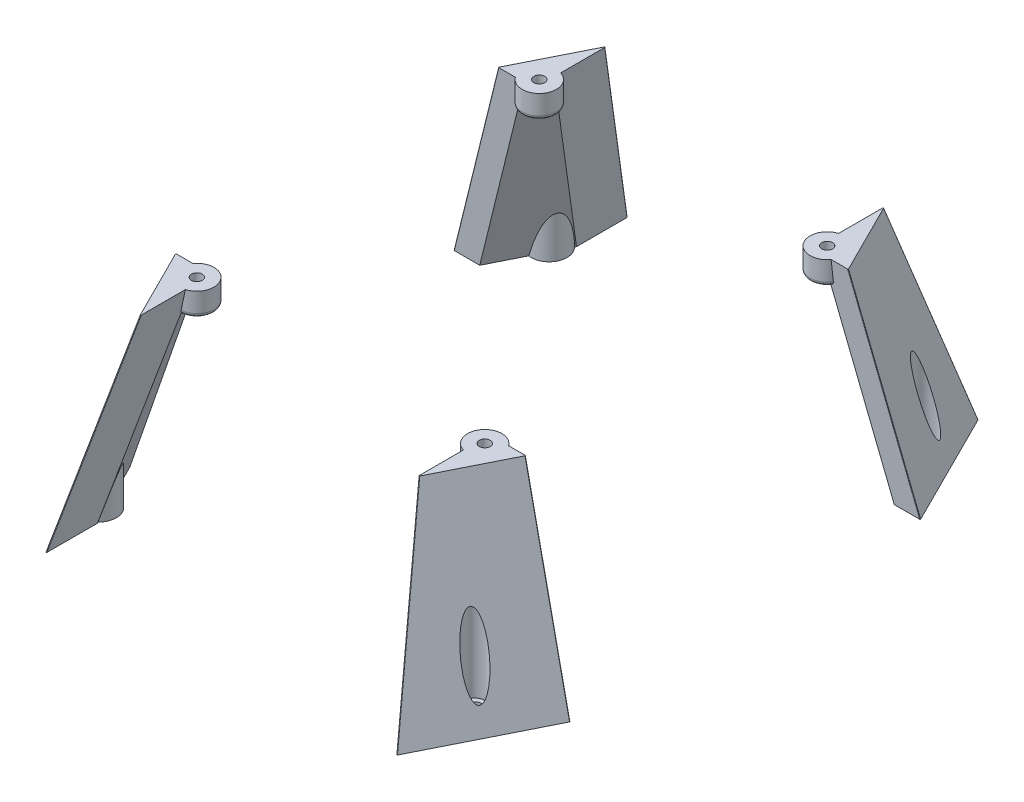
from build123d import *
from build123d.topology import SkipClean

# Parameters (mm, degrees)
SKETCH1_W                       = 120
SKETCH1_H                       = 150
BOSS_EXTRUDE1_DEPTH             = 3
BOSS_EXTRUDE2_REACH             = 98.094
BOSS_EXTRUDE2_DIRECTION_2_REACH = 98.094
CUT_EXTRUDE1_START              = 18
CUT_EXTRUDE1_DEPTH              = 50.8
CUT_EXTRUDE2_DEPTH              = 99.222526147
BOSS_EXTRUDE3_DEPTH             = 4
CUT_EXTRUDE3_DEPTH              = 4
CUT_EXTRUDE4_DEPTH              = 109.282039309
SKETCH10_R                      = 4.4
SKETCH10_R_2                    = 1.4
BOSS_EXTRUDE4_DEPTH             = 6
SKETCH10_2_R                    = 1.4
CUT_EXTRUDE5_DEPTH              = 109.282039309
FILLET1_R                       = 1
FILLET2_R                       = 1
FILLET3_R                       = 1
FILLET4_R                       = 1
BOSS_EXTRUDE5_START             = -10.666667
BOSS_EXTRUDE5_DEPTH             = 10.666667
BOSS_EXTRUDE7_START             = -10.666667
BOSS_EXTRUDE7_DEPTH             = 10.666667
BOSS_EXTRUDE8_START             = -10.666667
BOSS_EXTRUDE8_DEPTH             = 10.666667
BOSS_EXTRUDE9_START             = -10.666667
BOSS_EXTRUDE9_DEPTH             = 10.666667
SKETCH12_3_R                    = 1.6
CUT_EXTRUDE6_DEPTH              = 109.282039309
CUT_EXTRUDE7_START              = -4
SKETCH13_R                      = 2.75
CUT_EXTRUDE7_DEPTH              = 105.282039309
FILLET5_R                       = 0.1
FILLET6_R                       = 0.1
FILLET7_R                       = 0.1
FILLET8_R                       = 0.1


# Read off the part's stored shape, not the designer's step: Mirror3
with BuildPart() as part:
    # Sketch1 → Boss-Extrude1 (new, symmetric)
    with BuildSketch(Plane(origin=(0, 0, 0), x_dir=(1, 0, 0), z_dir=(0, 1, 0))):
        Rectangle(SKETCH1_W, SKETCH1_H)
    extrude(amount=BOSS_EXTRUDE1_DEPTH, both=True)

    # Boss-Extrude2: up to this face of the body (flat: up to its plane)
    boss_extrude2_end = Plane(part.part.faces().sort_by_distance((0, 0, 75))[0])
    # Sketch2 → Boss-Extrude2 (add, up to the picked face)
    with BuildSketch(Plane.XY, mode=Mode.PRIVATE) as boss_extrude2_sk1:
        Polygon((-60, -3), (-60, -17.558809371), (-20, -3), align=None)
    boss_extrude2_tool1 = split(extrude(boss_extrude2_sk1.sketch, amount=BOSS_EXTRUDE2_REACH, mode=Mode.PRIVATE), bisect_by=boss_extrude2_end, keep=Keep.BOTH, mode=Mode.PRIVATE)
    # Sketch2 → Boss-Extrude2 (add, up to the picked face)
    with BuildSketch(Plane.XY, mode=Mode.PRIVATE) as boss_extrude2_sk2:
        Polygon((20, -3), (60, -3), (60, -17.558809371), align=None)
    boss_extrude2_tool2 = split(extrude(boss_extrude2_sk2.sketch, amount=BOSS_EXTRUDE2_REACH, mode=Mode.PRIVATE), bisect_by=boss_extrude2_end, keep=Keep.BOTH, mode=Mode.PRIVATE)
    add(boss_extrude2_tool1.solids().sort_by(Axis((-46.666667, -7.852936, 0), (0, 0, 1)))[0])
    add(boss_extrude2_tool2.solids().sort_by(Axis((46.666667, -7.852936, 0), (0, 0, 1)))[0])

    # Boss-Extrude2 direction 2: up to this face of the body (flat: up to its plane)
    boss_extrude2_direction_2_end = Plane(part.part.faces().sort_by_distance((0, 0, -75))[0])
    # Sketch2 → Boss-Extrude2 direction 2 (add, up to the picked face)
    with BuildSketch(Plane.XY, mode=Mode.PRIVATE) as boss_extrude2_direction_2_sk1:
        Polygon((-60, -3), (-60, -17.558809371), (-20, -3), align=None)
    boss_extrude2_direction_2_tool1 = split(extrude(boss_extrude2_direction_2_sk1.sketch, amount=-BOSS_EXTRUDE2_DIRECTION_2_REACH, mode=Mode.PRIVATE), bisect_by=boss_extrude2_direction_2_end, keep=Keep.BOTH, mode=Mode.PRIVATE)
    # Sketch2 → Boss-Extrude2 direction 2 (add, up to the picked face)
    with BuildSketch(Plane.XY, mode=Mode.PRIVATE) as boss_extrude2_direction_2_sk2:
        Polygon((20, -3), (60, -3), (60, -17.558809371), align=None)
    boss_extrude2_direction_2_tool2 = split(extrude(boss_extrude2_direction_2_sk2.sketch, amount=-BOSS_EXTRUDE2_DIRECTION_2_REACH, mode=Mode.PRIVATE), bisect_by=boss_extrude2_direction_2_end, keep=Keep.BOTH, mode=Mode.PRIVATE)
    add(boss_extrude2_direction_2_tool1.solids().sort_by(Axis((-46.666667, -7.852936, 0), (0, 0, -1)))[0])
    add(boss_extrude2_direction_2_tool2.solids().sort_by(Axis((46.666667, -7.852936, 0), (0, 0, -1)))[0])

    # Sketch3 → Cut-Extrude1 (cut)
    with BuildSketch(Plane.XY.offset(CUT_EXTRUDE1_START)):
        Polygon((-20, -3), (-46.314239601, -3), (-60, -7.981209418), (-60, -13.302098281), (-45.432604698, -8), (-33.737387097, -8), align=None)
        Polygon((33.737387097, -8), (20, -3), (46.314239601, -3), (60, -7.981209418), (60, -13.302098281), (45.432604698, -8), align=None)
    cut_extrude1 = extrude(amount=CUT_EXTRUDE1_DEPTH, mode=Mode.SUBTRACT)

    # Mirror1: Cut-Extrude1 across plane
    add(cut_extrude1.mirror(Plane.XY), mode=Mode.SUBTRACT)

    # Sketch5 → Cut-Extrude2 (cut, through all)
    with BuildSketch(Plane(origin=(0, 3, 0), x_dir=(1, 0, 0), z_dir=(0, 1, 0))):
        Polygon((-60, -75), (-60, -45), (-45, -75), align=None)
        Polygon((45, -75), (60, -75), (60, -45), align=None)
        Polygon((60, 75), (60, 45), (45, 75), align=None)
        Polygon((-45, 75), (-60, 75), (-60, 45), align=None)
    extrude(amount=-CUT_EXTRUDE2_DEPTH, mode=Mode.SUBTRACT)



with BuildPart() as body_2:
    # Sketch4 → Boss-Extrude3 (new body)
    with BuildSketch(Plane(origin=(0, 53, 0), x_dir=(1, 0, 0), z_dir=(0, 1, 0))):
        Polygon((-35.729490169, 60), (-45, 41.458980338), (-45, -41.458980338), (-35.729490169, -60), (35.729490169, -60), (45, -41.458980338), (45, 41.458980338), (35.729490169, 60), align=None)
    extrude(amount=BOSS_EXTRUDE3_DEPTH)


with BuildPart() as part_1:
    add(part.part)

    add(body_2.part)  # Loft3 merges body 2
    # Sketch6 → Loft3 section 0
    with BuildSketch(Plane(origin=(0, 3, 0), x_dir=(1, 0, 0), z_dir=(0, 1, 0))):
        with BuildLine():
            Line((-60, -45), (-53.291796068, -45))
            Line((-53.291796068, -45), (-45, -61.583592135))
            Line((-45, -61.583592135), (-45, -75))
            Line((-45, -75), (-60, -45))
        make_face()
    # Sketch7 → Loft3 section 1
    with BuildSketch(Plane(origin=(0, 53, 0), x_dir=(-1, 0, 0), z_dir=(0, -1, 0))):
        with BuildLine():
            Line((35.729490169, -60), (35.729490169, -46.583592135))
            Line((35.729490169, -46.583592135), (38.291796068, -41.458980338))
            Line((38.291796068, -41.458980338), (45, -41.458980338))
            Line((45, -41.458980338), (35.729490169, -60))
        make_face()
    loft3 = loft()

    # Mirror2: Loft3 across plane
    add(loft3.mirror(Plane(origin=(0, 0, 0), x_dir=(0, 0, 1), z_dir=(1, 0, 0))))

    # Mirror3: part across plane


with BuildPart() as part_2:
    add(part_1.part)
    add(part_1.part.mirror(Plane.XY))

    # Sketch8 → Cut-Extrude3 (cut)
    with BuildSketch(Plane(origin=(0, 57, 0), x_dir=(1, 0, 0), z_dir=(0, 1, 0))):
        Polygon((35.729490169, 60), (-35.729490169, 60), (-45, 41.458980338), (-45, -41.458980338), (-35.729490169, -60), (35.729490169, -60), (45, -41.458980338), (45, 41.458980338), align=None)
    extrude(amount=-CUT_EXTRUDE3_DEPTH, mode=Mode.SUBTRACT)

    # Sketch9 → Cut-Extrude4 (cut, through all)
    with BuildSketch(Plane(origin=(0, 3, 0), x_dir=(1, 0, 0), z_dir=(0, 1, 0))):
        Polygon((60, -45), (45, -75.0000125), (-45, -75), (-60, -45), (-60, 45), (-45, 75), (45, 75), (60, 45), align=None)
    extrude(amount=-CUT_EXTRUDE4_DEPTH, mode=Mode.SUBTRACT)


with BuildPart() as cut_extrude4_piece_1:
    # of the separate pieces the step leaves, piece 1, a body of its own (cut_extrude4_pieces)
    add(part_2.part.solids().sort_by_distance((-60, 3, -45))[0])



with BuildPart() as cut_extrude4_piece_2:
    # of the separate pieces the step leaves, piece 2, a body of its own (cut_extrude4_pieces)
    add(part_2.part.solids().sort_by_distance((-60, 3, 45))[0])


with BuildPart() as cut_extrude4_piece_3:
    # of the separate pieces the step leaves, piece 3, a body of its own (cut_extrude4_pieces)
    add(part_2.part.solids().sort_by_distance((60, 3, -45))[0])


with BuildPart() as cut_extrude4_piece_4:
    # of the separate pieces the step leaves, piece 4, a body of its own (cut_extrude4_pieces)
    add(part_2.part.solids().sort_by_distance((45, 3, 61.583592135))[0])


with BuildPart() as cut_extrude4_piece_1_1:
    add(cut_extrude4_piece_1.part)

    add(cut_extrude4_piece_2.part)  # Boss-Extrude4 merges Cut-Extrude4 piece 2

    add(cut_extrude4_piece_3.part)  # Boss-Extrude4 merges Cut-Extrude4 piece 3

    add(cut_extrude4_piece_4.part)  # Boss-Extrude4 merges Cut-Extrude4 piece 4
    # Sketch10 → Boss-Extrude4 (add)
    # profile 1 of 4: a face of its own
    with BuildSketch(Plane(origin=(0, 53, 0), x_dir=(1, 0, 0), z_dir=(0, 1, 0))):
        with Locations((-37.010643118, -44.021286236)):
            Circle(SKETCH10_R)
        with Locations(Location((-37.010643118, -44.021286236, 0), (0, 0, 270))):
            Circle(SKETCH10_R_2, mode=Mode.SUBTRACT)
    # profile 2 of 4: a face of its own
    with BuildSketch(Plane(origin=(0, 53, 0), x_dir=(1, 0, 0), z_dir=(0, 1, 0))):
        with Locations((37.010643118, -44.021286236)):
            Circle(SKETCH10_R)
        with Locations(Location((37.010643118, -44.021286236, 0), (0, 0, 243.434948823))):
            Circle(SKETCH10_R_2, mode=Mode.SUBTRACT)
    # profile 3 of 4: a face of its own
    with BuildSketch(Plane(origin=(0, 53, 0), x_dir=(1, 0, 0), z_dir=(0, 1, 0))):
        with Locations((37.010643118, 44.021286236)):
            Circle(SKETCH10_R)
        with Locations(Location((37.010643118, 44.021286236, 0), (0, 0, 270))):
            Circle(SKETCH10_R_2, mode=Mode.SUBTRACT)
    # profile 4 of 4: a face of its own
    with BuildSketch(Plane(origin=(0, 53, 0), x_dir=(1, 0, 0), z_dir=(0, 1, 0))):
        with Locations((-37.010643118, 44.021286236)):
            Circle(SKETCH10_R)
        with Locations(Location((-37.010643118, 44.021286236, 0), (0, 0, 243.434948823))):
            Circle(SKETCH10_R_2, mode=Mode.SUBTRACT)
    extrude(amount=-BOSS_EXTRUDE4_DEPTH)

    # Sketch10<2> → Cut-Extrude5 (cut, through all)
    with SkipClean():  # the faces are left unmerged after this step: merging them gives an invalid solid
        with BuildSketch(Plane(origin=(0, 53, 0), x_dir=(1, 0, 0), z_dir=(0, 1, 0))):
            with BuildLine():
                ThreePointArc((-36.384544084, -45.273484304), (-35.819731986, -44.757309793), (-35.610643118, -44.021286236))
                ThreePointArc((-35.610643118, -44.021286236), (-36.274619561, -42.830375105), (-37.636742152, -42.769088169))
                Line((-37.636742152, -42.769088169), (-36.384544084, -45.273484304))
            make_face()
            with BuildLine():
                Line((-36.384544084, -45.273484304), (-37.636742152, -42.769088169))
                ThreePointArc((-37.636742152, -42.769088169), (-38.262841186, -44.64738527), (-36.384544084, -45.273484304))
            make_face()
            with Locations(Location((37.010643118, -44.021286236, 0), (0, 0, 90))):
                Circle(SKETCH10_2_R)
            with Locations(Location((37.010643118, 44.021286236, 0), (0, 0, 270))):
                Circle(SKETCH10_2_R)
            with Locations(Location((-37.010643118, 44.021286236, 0), (0, 0, 90))):
                Circle(SKETCH10_2_R)
        extrude(amount=-CUT_EXTRUDE5_DEPTH, mode=Mode.SUBTRACT)

    # Fillet1
    fillet1_edges = [cut_extrude4_piece_1_1.edges().sort_by_distance(p)[0] for p in [
        (-33.261724109, 47, 41.717896068),
    ]]
    fillet(fillet1_edges, radius=FILLET1_R)

    # Fillet2
    fillet2_edges = [cut_extrude4_piece_1_1.edges().sort_by_distance(p)[0] for p in [
        (-33.261724109, 47, -41.717896068),
    ]]
    fillet(fillet2_edges, radius=FILLET2_R)

    # Fillet3
    fillet3_edges = [cut_extrude4_piece_1_1.edges().sort_by_distance(p)[0] for p in [
        (33.261724109, 47, -41.717896068),
    ]]
    fillet(fillet3_edges, radius=FILLET3_R)

    # Fillet4
    fillet4_edges = [cut_extrude4_piece_1_1.edges().sort_by_distance(p)[0] for p in [
        (33.261724109, 47, 41.717896068),
    ]]
    fillet(fillet4_edges, radius=FILLET4_R)

    # Sketch12 → Boss-Extrude5 (add)
    with SkipClean():  # the faces are left unmerged after this step: merging them gives an invalid solid
        with BuildSketch(Plane.XZ.offset(-3).offset(BOSS_EXTRUDE5_START)):
            with BuildLine():
                Line((-47.479847016, 56.623898104), (-49.093028648, 53.397534839))
                ThreePointArc((-49.093028648, 53.397534839), (-45.393479439, 54.448964921), (-43.785634921, 57.942817461))
                ThreePointArc((-43.785634921, 57.942817461), (-44.146871342, 59.729681562), (-45.17384506, 61.235902015))
                Line((-45.17384506, 61.235902015), (-46.787026692, 58.00953875))
                ThreePointArc((-46.787026692, 58.00953875), (-46.785982902, 57.976185362), (-46.785634921, 57.942817461))
                ThreePointArc((-46.785634921, 57.942817461), (-46.969785238, 57.197586171), (-47.479847016, 56.623898104))
            make_face()
        extrude(amount=BOSS_EXTRUDE5_DEPTH)

    # Sketch12<6> → Boss-Extrude7 (add)
    with SkipClean():  # the faces are left unmerged after this step: merging them gives an invalid solid
        with BuildSketch(Plane.XZ.offset(-3).offset(BOSS_EXTRUDE7_START)):
            with BuildLine():
                ThreePointArc((45.17384506, 61.235902015), (44.271269843, 55.885634921), (49.093028648, 53.397534839))
                Line((49.093028648, 53.397534839), (47.479847016, 56.623898104))
                ThreePointArc((47.479847016, 56.623898104), (46.954551416, 57.227275708), (46.787026692, 58.00953875))
                Line((46.787026692, 58.00953875), (45.17384506, 61.235902015))
            make_face()
        extrude(amount=BOSS_EXTRUDE7_DEPTH)

    # Sketch12<7> → Boss-Extrude8 (add)
    with SkipClean():  # the faces are left unmerged after this step: merging them gives an invalid solid
        with BuildSketch(Plane.XZ.offset(-3).offset(BOSS_EXTRUDE8_START)):
            with BuildLine():
                Line((47.479847016, -56.623898104), (49.093028648, -53.397534839))
                ThreePointArc((49.093028648, -53.397534839), (44.271269843, -55.885634921), (45.17384506, -61.235902015))
                Line((45.17384506, -61.235902015), (46.787026692, -58.00953875))
                ThreePointArc((46.787026692, -58.00953875), (46.954551416, -57.227275708), (47.479847016, -56.623898104))
            make_face()
        extrude(amount=BOSS_EXTRUDE8_DEPTH)

    # Sketch12<8> → Boss-Extrude9 (add)
    with SkipClean():  # the faces are left unmerged after this step: merging them gives an invalid solid
        with BuildSketch(Plane.XZ.offset(-3).offset(BOSS_EXTRUDE9_START)):
            with BuildLine():
                ThreePointArc((-43.785634921, -57.942817461), (-45.393479439, -54.448964921), (-49.093028648, -53.397534839))
                Line((-49.093028648, -53.397534839), (-47.479847016, -56.623898104))
                ThreePointArc((-47.479847016, -56.623898104), (-46.969785238, -57.197586171), (-46.785634921, -57.942817461))
                ThreePointArc((-46.785634921, -57.942817461), (-46.785982902, -57.976185362), (-46.787026692, -58.00953875))
                Line((-46.787026692, -58.00953875), (-45.17384506, -61.235902015))
                ThreePointArc((-45.17384506, -61.235902015), (-44.146871342, -59.729681562), (-43.785634921, -57.942817461))
            make_face()
        extrude(amount=BOSS_EXTRUDE9_DEPTH)

    # Sketch12<3> → Cut-Extrude6 (cut, through all)
    with SkipClean():  # the faces are left unmerged after this step: merging them gives an invalid solid
        with BuildSketch(Plane.XZ.offset(-3)):
            with BuildLine():
                ThreePointArc((-46.787026692, 58.00953875), (-49.816718427, 58.658359214), (-47.479847016, 56.623898104))
                Line((-47.479847016, 56.623898104), (-46.787026692, 58.00953875))
            make_face()
            with BuildLine():
                Line((-46.787026692, 58.00953875), (-47.479847016, 56.623898104))
                ThreePointArc((-47.479847016, 56.623898104), (-46.969785238, 57.197586171), (-46.785634921, 57.942817461))
                ThreePointArc((-46.785634921, 57.942817461), (-46.785982902, 57.976185362), (-46.787026692, 58.00953875))
            make_face()
            with BuildLine():
                ThreePointArc((49.985634921, -57.942817461), (49.130866211, -56.526967778), (47.479847016, -56.623898104))
                Line((47.479847016, -56.623898104), (46.787026692, -58.00953875))
                ThreePointArc((46.787026692, -58.00953875), (48.419002823, -59.54246948), (49.985634921, -57.942817461))
            make_face()
            with BuildLine():
                Line((46.787026692, -58.00953875), (47.479847016, -56.623898104))
                ThreePointArc((47.479847016, -56.623898104), (46.954551416, -57.227275708), (46.787026692, -58.00953875))
            make_face()
            with BuildLine():
                ThreePointArc((-46.785634921, -57.942817461), (-46.969785238, -57.197586171), (-47.479847016, -56.623898104))
                Line((-47.479847016, -56.623898104), (-46.787026692, -58.00953875))
                ThreePointArc((-46.787026692, -58.00953875), (-46.785982902, -57.976185362), (-46.785634921, -57.942817461))
            make_face()
            with BuildLine():
                Line((-46.787026692, -58.00953875), (-47.479847016, -56.623898104))
                ThreePointArc((-47.479847016, -56.623898104), (-49.816718427, -58.658359214), (-46.787026692, -58.00953875))
            make_face()
            with Locations(Location((48.385634921, 57.942817461, 0), (0, 0, 270))):
                Circle(SKETCH12_3_R)
        extrude(amount=-CUT_EXTRUDE6_DEPTH, mode=Mode.SUBTRACT)

    # Sketch13 → Cut-Extrude7 (cut, through all)
    with SkipClean():  # the faces are left unmerged after this step: merging them gives an invalid solid
        with BuildSketch(Plane.XZ.offset(-3).offset(CUT_EXTRUDE7_START)):
            with Locations(Location((-48.385634921, 57.942817461, 0), (0, 0, 270))):
                Circle(SKETCH13_R)
            with Locations(Location((48.385634921, 57.942817461, 0), (0, 0, 26.565051177))):
                Circle(SKETCH13_R)
            with Locations(Location((48.385634921, -57.942817461, 0), (0, 0, 270))):
                Circle(SKETCH13_R)
            with Locations(Location((-48.385634921, -57.942817461, 0), (0, 0, 206.565051177))):
                Circle(SKETCH13_R)
        extrude(amount=-CUT_EXTRUDE7_DEPTH, mode=Mode.SUBTRACT)

    # Fillet5
    fillet5_edges = [cut_extrude4_piece_1_1.edges().sort_by_distance(p)[0] for p in [
        (-52.5, 28, 43.229490169),
        (-40.364745084, 28, 67.5),
    ]]
    fillet(fillet5_edges, radius=FILLET5_R)

    # Fillet6
    fillet6_edges = [cut_extrude4_piece_1_1.edges().sort_by_distance(p)[0] for p in [
        (-52.5, 28, -43.229490169),
        (-40.364745084, 28, -67.5),
    ]]
    fillet(fillet6_edges, radius=FILLET6_R)

    # Fillet7
    fillet7_edges = [cut_extrude4_piece_1_1.edges().sort_by_distance(p)[0] for p in [
        (52.5, 28, -43.229490169),
        (40.364745084, 28, -67.5),
    ]]
    fillet(fillet7_edges, radius=FILLET7_R)

    # Fillet8
    fillet8_edges = [cut_extrude4_piece_1_1.edges().sort_by_distance(p)[0] for p in [
        (40.364745084, 28, 67.5),
        (52.5, 28, 43.229490169),
    ]]
    fillet(fillet8_edges, radius=FILLET8_R)


solid = cut_extrude4_piece_1_1.part
